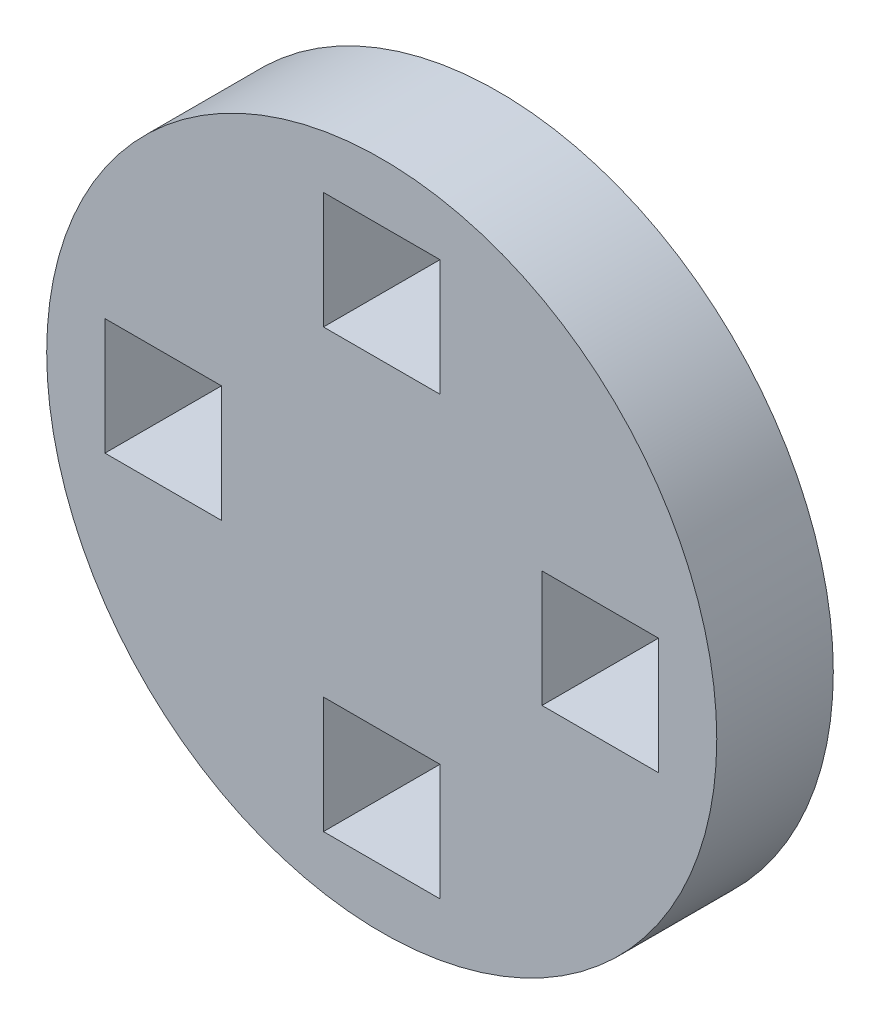
from build123d import *

# Parameters (mm, degrees)
SKETCH1_R           = 11.5
SKETCH1_W           = 4
SKETCH1_H           = 4
BOSS_EXTRUDE1_DEPTH = 4


with BuildPart() as part:
    # Sketch1 → Boss-Extrude1 (new body)
    with BuildSketch(Plane.XY):
        Circle(SKETCH1_R)
        with Locations((0, 7.5)):
            Rectangle(SKETCH1_W, SKETCH1_H, mode=Mode.SUBTRACT)
        with Locations((7.5, 0)):
            Rectangle(SKETCH1_W, SKETCH1_H, mode=Mode.SUBTRACT)
        with Locations((0, -7.5)):
            Rectangle(SKETCH1_W, SKETCH1_H, mode=Mode.SUBTRACT)
        with Locations((-7.5, 0)):
            Rectangle(SKETCH1_W, SKETCH1_H, mode=Mode.SUBTRACT)
    extrude(amount=BOSS_EXTRUDE1_DEPTH)


solid = part.part
